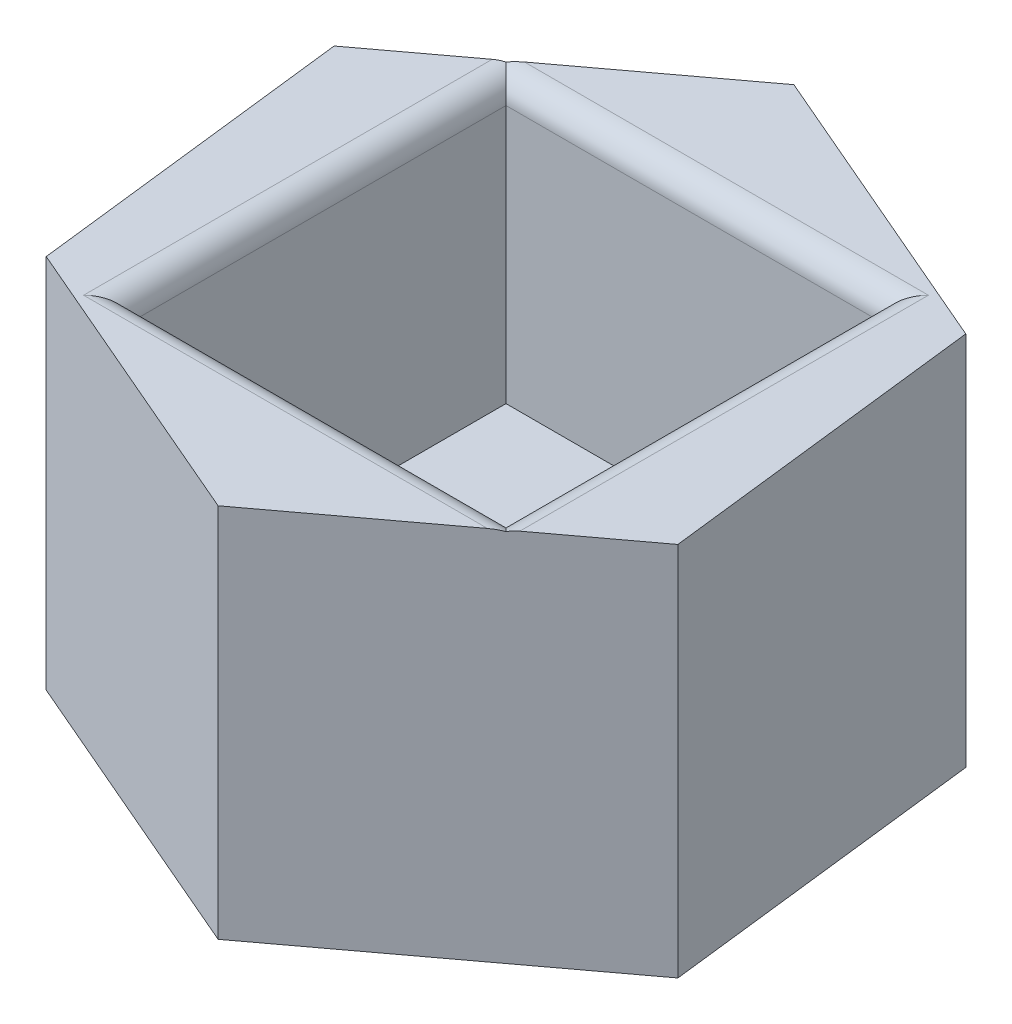
from build123d import *

# Parameters (mm, degrees)
BOSS_EXTRUDE1_DEPTH = 4
SKETCH2_W           = 4
SKETCH2_H           = 4
CUT_EXTRUDE1_DEPTH  = 3
FILLET1_R           = 0.25


with BuildPart() as part:
    # Sketch1 → Boss-Extrude1 (new body)
    with BuildSketch(Plane(origin=(0, 0, 0), x_dir=(1, 0, 0), z_dir=(0, 1, 0))):
        Polygon((3.214834695, -1.383776673), (2.8058031, 2.092240179), (-0.409031596, 3.476016852), (-3.214834695, 1.383776673), (-2.8058031, -2.092240179), (0.409031596, -3.476016852), align=None)
    extrude(amount=BOSS_EXTRUDE1_DEPTH)

    # Sketch2 → Cut-Extrude1 (cut)
    with BuildSketch(Plane(origin=(0, 4, 0), x_dir=(1, 0, 0), z_dir=(0, 1, 0))):
        Rectangle(SKETCH2_W, SKETCH2_H)
    extrude(amount=-CUT_EXTRUDE1_DEPTH, mode=Mode.SUBTRACT)

    # Fillet1
    # the kernel refuses this fillet: 0.25 mm, written as the material it takes off along each edge
    with BuildSketch(Plane(origin=(-2, 4, -2), x_dir=(-1, 0, 0), z_dir=(0, 0, 1)), Plane(origin=(2, 4, -2), x_dir=(0, 0, -1), z_dir=(-1, 0, 0)), Plane(origin=(-2, 4, 2), x_dir=(0, 0, 1), z_dir=(1, 0, 0)), Plane(origin=(2, 4, 2), x_dir=(1, 0, 0), z_dir=(0, 0, -1))) as fillet1_piece_1:
        with BuildLine():
            CenterArc((FILLET1_R, FILLET1_R), FILLET1_R, 180, 90)
            Line((0, FILLET1_R), (-FILLET1_R * 0.02, FILLET1_R))
            Line((-FILLET1_R * 0.02, FILLET1_R), (-FILLET1_R * 0.02, -FILLET1_R * 0.02))
            Line((-FILLET1_R * 0.02, -FILLET1_R * 0.02), (FILLET1_R, -FILLET1_R * 0.02))
            Line((FILLET1_R, -FILLET1_R * 0.02), (FILLET1_R, 0))
        make_face()
    extrude(amount=4, mode=Mode.SUBTRACT)
    with BuildSketch(Plane(origin=(2, 4, -2), x_dir=(0, 0, -1), z_dir=(-1, 0, 0))) as fillet1_piece_2a_section:
        with BuildLine():
            CenterArc((FILLET1_R, FILLET1_R), FILLET1_R, 180, 90)
            Line((0, FILLET1_R), (-FILLET1_R * 0.02, FILLET1_R))
            Line((-FILLET1_R * 0.02, FILLET1_R), (-FILLET1_R * 0.02, -FILLET1_R * 0.02))
            Line((-FILLET1_R * 0.02, -FILLET1_R * 0.02), (FILLET1_R, -FILLET1_R * 0.02))
            Line((FILLET1_R, -FILLET1_R * 0.02), (FILLET1_R, 0))
        make_face()
    fillet1_piece_2a = extrude(amount=4.625, mode=Mode.PRIVATE)
    fillet1_piece_2a = split(fillet1_piece_2a, bisect_by=Plane(origin=(-2, 3.943401221, -2.056598779), z_dir=(-1, 0, 0)), keep=Keep.TOP, mode=Mode.PRIVATE)
    with BuildSketch(Plane(origin=(-2, 4, -2.625), x_dir=(-1, 0, 0), z_dir=(0, 0, 1))) as fillet1_piece_2b_section:
        with BuildLine():
            CenterArc((FILLET1_R, FILLET1_R), FILLET1_R, 180, 90)
            Line((0, FILLET1_R), (-FILLET1_R * 0.02, FILLET1_R))
            Line((-FILLET1_R * 0.02, FILLET1_R), (-FILLET1_R * 0.02, -FILLET1_R * 0.02))
            Line((-FILLET1_R * 0.02, -FILLET1_R * 0.02), (FILLET1_R, -FILLET1_R * 0.02))
            Line((FILLET1_R, -FILLET1_R * 0.02), (FILLET1_R, 0))
        make_face()
    fillet1_piece_2b = extrude(amount=4.625, mode=Mode.PRIVATE)
    fillet1_piece_2b = split(fillet1_piece_2b, bisect_by=Plane(origin=(-2.056598779, 3.943401221, -2), z_dir=(0, 0, -1)), keep=Keep.TOP, mode=Mode.PRIVATE)
    fillet1_piece_2 = fillet1_piece_2a & fillet1_piece_2b
    add(fillet1_piece_2, mode=Mode.SUBTRACT)
    with BuildSketch(Plane(origin=(-2.625, 4, 2), x_dir=(0, 0, 1), z_dir=(1, 0, 0))) as fillet1_piece_3a_section:
        with BuildLine():
            CenterArc((FILLET1_R, FILLET1_R), FILLET1_R, 180, 90)
            Line((0, FILLET1_R), (-FILLET1_R * 0.02, FILLET1_R))
            Line((-FILLET1_R * 0.02, FILLET1_R), (-FILLET1_R * 0.02, -FILLET1_R * 0.02))
            Line((-FILLET1_R * 0.02, -FILLET1_R * 0.02), (FILLET1_R, -FILLET1_R * 0.02))
            Line((FILLET1_R, -FILLET1_R * 0.02), (FILLET1_R, 0))
        make_face()
    fillet1_piece_3a = extrude(amount=4.625, mode=Mode.PRIVATE)
    fillet1_piece_3a = split(fillet1_piece_3a, bisect_by=Plane(origin=(-2, 3.943401221, 2.056598779), z_dir=(-1, 0, 0)), keep=Keep.TOP, mode=Mode.PRIVATE)
    with BuildSketch(Plane(origin=(-2, 4, -2), x_dir=(-1, 0, 0), z_dir=(0, 0, 1))) as fillet1_piece_3b_section:
        with BuildLine():
            CenterArc((FILLET1_R, FILLET1_R), FILLET1_R, 180, 90)
            Line((0, FILLET1_R), (-FILLET1_R * 0.02, FILLET1_R))
            Line((-FILLET1_R * 0.02, FILLET1_R), (-FILLET1_R * 0.02, -FILLET1_R * 0.02))
            Line((-FILLET1_R * 0.02, -FILLET1_R * 0.02), (FILLET1_R, -FILLET1_R * 0.02))
            Line((FILLET1_R, -FILLET1_R * 0.02), (FILLET1_R, 0))
        make_face()
    fillet1_piece_3b = extrude(amount=4.625, mode=Mode.PRIVATE)
    fillet1_piece_3b = split(fillet1_piece_3b, bisect_by=Plane(origin=(-2.056598779, 3.943401221, 2), z_dir=(0, 0, 1)), keep=Keep.TOP, mode=Mode.PRIVATE)
    fillet1_piece_3 = fillet1_piece_3a & fillet1_piece_3b
    add(fillet1_piece_3, mode=Mode.SUBTRACT)
    with BuildSketch(Plane(origin=(2, 4, 2), x_dir=(1, 0, 0), z_dir=(0, 0, -1))) as fillet1_piece_4a_section:
        with BuildLine():
            CenterArc((FILLET1_R, FILLET1_R), FILLET1_R, 180, 90)
            Line((0, FILLET1_R), (-FILLET1_R * 0.02, FILLET1_R))
            Line((-FILLET1_R * 0.02, FILLET1_R), (-FILLET1_R * 0.02, -FILLET1_R * 0.02))
            Line((-FILLET1_R * 0.02, -FILLET1_R * 0.02), (FILLET1_R, -FILLET1_R * 0.02))
            Line((FILLET1_R, -FILLET1_R * 0.02), (FILLET1_R, 0))
        make_face()
    fillet1_piece_4a = extrude(amount=4.625, mode=Mode.PRIVATE)
    fillet1_piece_4a = split(fillet1_piece_4a, bisect_by=Plane(origin=(2.056598779, 3.943401221, -2), z_dir=(0, 0, -1)), keep=Keep.TOP, mode=Mode.PRIVATE)
    with BuildSketch(Plane(origin=(2.625, 4, -2), x_dir=(0, 0, -1), z_dir=(-1, 0, 0))) as fillet1_piece_4b_section:
        with BuildLine():
            CenterArc((FILLET1_R, FILLET1_R), FILLET1_R, 180, 90)
            Line((0, FILLET1_R), (-FILLET1_R * 0.02, FILLET1_R))
            Line((-FILLET1_R * 0.02, FILLET1_R), (-FILLET1_R * 0.02, -FILLET1_R * 0.02))
            Line((-FILLET1_R * 0.02, -FILLET1_R * 0.02), (FILLET1_R, -FILLET1_R * 0.02))
            Line((FILLET1_R, -FILLET1_R * 0.02), (FILLET1_R, 0))
        make_face()
    fillet1_piece_4b = extrude(amount=4.625, mode=Mode.PRIVATE)
    fillet1_piece_4b = split(fillet1_piece_4b, bisect_by=Plane(origin=(2, 3.943401221, -2.056598779), z_dir=(1, 0, 0)), keep=Keep.TOP, mode=Mode.PRIVATE)
    fillet1_piece_4 = fillet1_piece_4a & fillet1_piece_4b
    add(fillet1_piece_4, mode=Mode.SUBTRACT)
    with BuildSketch(Plane(origin=(-2, 4, 2), x_dir=(0, 0, 1), z_dir=(1, 0, 0))) as fillet1_piece_5a_section:
        with BuildLine():
            CenterArc((FILLET1_R, FILLET1_R), FILLET1_R, 180, 90)
            Line((0, FILLET1_R), (-FILLET1_R * 0.02, FILLET1_R))
            Line((-FILLET1_R * 0.02, FILLET1_R), (-FILLET1_R * 0.02, -FILLET1_R * 0.02))
            Line((-FILLET1_R * 0.02, -FILLET1_R * 0.02), (FILLET1_R, -FILLET1_R * 0.02))
            Line((FILLET1_R, -FILLET1_R * 0.02), (FILLET1_R, 0))
        make_face()
    fillet1_piece_5a = extrude(amount=4.625, mode=Mode.PRIVATE)
    fillet1_piece_5a = split(fillet1_piece_5a, bisect_by=Plane(origin=(2, 3.943401221, 2.056598779), z_dir=(1, 0, 0)), keep=Keep.TOP, mode=Mode.PRIVATE)
    with BuildSketch(Plane(origin=(2, 4, 2.625), x_dir=(1, 0, 0), z_dir=(0, 0, -1))) as fillet1_piece_5b_section:
        with BuildLine():
            CenterArc((FILLET1_R, FILLET1_R), FILLET1_R, 180, 90)
            Line((0, FILLET1_R), (-FILLET1_R * 0.02, FILLET1_R))
            Line((-FILLET1_R * 0.02, FILLET1_R), (-FILLET1_R * 0.02, -FILLET1_R * 0.02))
            Line((-FILLET1_R * 0.02, -FILLET1_R * 0.02), (FILLET1_R, -FILLET1_R * 0.02))
            Line((FILLET1_R, -FILLET1_R * 0.02), (FILLET1_R, 0))
        make_face()
    fillet1_piece_5b = extrude(amount=4.625, mode=Mode.PRIVATE)
    fillet1_piece_5b = split(fillet1_piece_5b, bisect_by=Plane(origin=(2.056598779, 3.943401221, 2), z_dir=(0, 0, 1)), keep=Keep.TOP, mode=Mode.PRIVATE)
    fillet1_piece_5 = fillet1_piece_5a & fillet1_piece_5b
    add(fillet1_piece_5, mode=Mode.SUBTRACT)


solid = part.part
